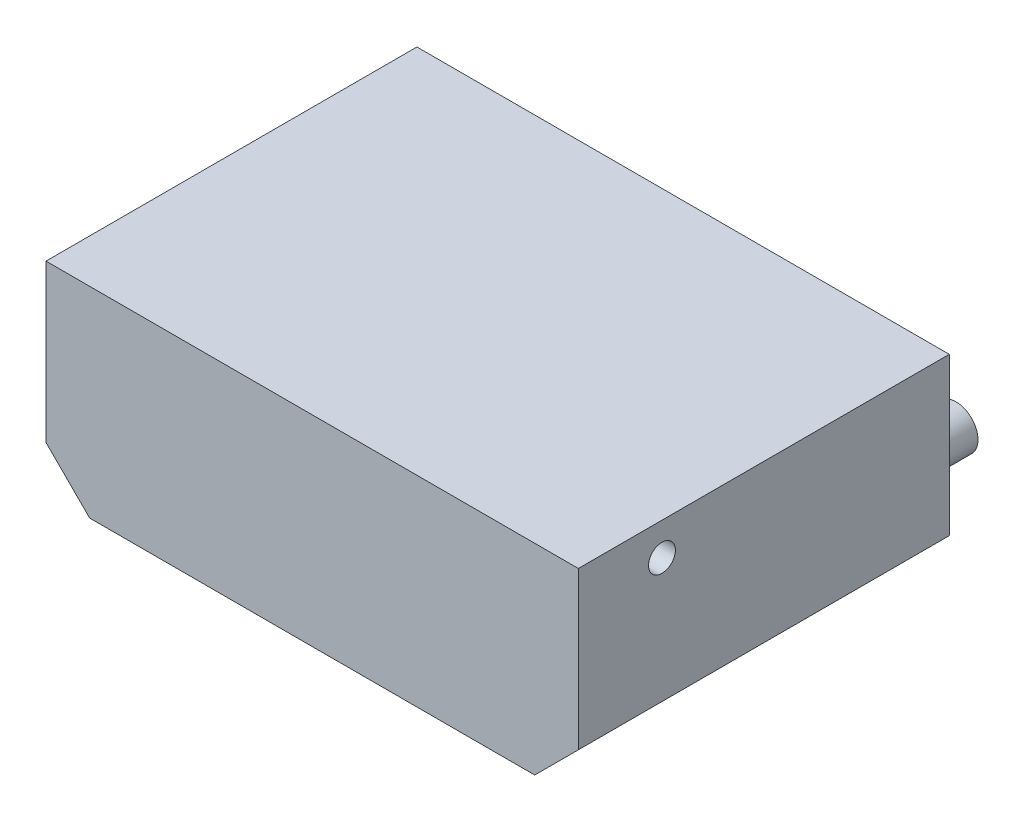
from build123d import *

# Parameters (mm, degrees)
BOSS_EXTRUDE1_DEPTH = 170
SKETCH2_W           = 174
SKETCH2_H           = 140
CUT_EXTRUDE1_DEPTH  = 0.1
SKETCH3_R           = 10
BOSS_EXTRUDE2_DEPTH = 18.7
CUT_EXTRUDE2_DEPTH  = 0.1
CUT_EXTRUDE3_REACH  = 302.919
SKETCH5_R           = 6.160372281


with BuildPart() as part:
    # Sketch1 → Boss-Extrude1 (new body)
    with BuildSketch(Plane.XY):
        Polygon((-102, -46), (-122, -26), (-122, 46), (122, 46), (122, -26), (102, -46), align=None)
    extrude(amount=BOSS_EXTRUDE1_DEPTH)

    # Sketch2 → Cut-Extrude1 (cut)
    with BuildSketch(Plane.XZ.offset(46)):
        with Locations((0, 85)):
            Rectangle(SKETCH2_W, SKETCH2_H)
    extrude(amount=-CUT_EXTRUDE1_DEPTH, mode=Mode.SUBTRACT)

    # Sketch3 → Boss-Extrude2 (add)
    with BuildSketch(Plane(origin=(0, 0, 0), x_dir=(-1, 0, 0), z_dir=(0, 0, -1))):
        with Locations((-76.475491295, 0)):
            Circle(SKETCH3_R)
        with Locations((-106.475491295, 0)):
            Circle(SKETCH3_R)
    extrude(amount=BOSS_EXTRUDE2_DEPTH)

    # Sketch4 → Cut-Extrude2 (cut)
    # profile 1 of 8: a face of its own
    with BuildSketch(Plane.XZ.offset(45.9)):
        with BuildLine():
            Line((-42.268322494, 131.561403862), (-42.268322494, 131.083569118))
            add(Edge.make_bspline(
                [(-42.268322494, 131.083569118), (-42.422310774, 131.050224304), (-42.731367697, 130.983300734), (-43.16425574, 130.761058835), (-43.574269447, 130.460579751), (-43.808169871, 130.202231607), (-43.929544846, 130.068170287)],
                knots=[0, 0, 0, 0, 0.947408205, 1.901463304, 2.911033016, 4, 4, 4, 4], degree=3))
            add(Edge.make_bspline(
                [(-43.929544846, 130.068170287), (-43.977852767, 130.0066807), (-44.085689478, 129.869418846), (-44.238600073, 129.62465817), (-44.411442585, 129.328958663), (-44.596616217, 128.976318721), (-44.800647362, 128.569989633), (-45.025747476, 128.112451902), (-45.259781717, 127.5979898), (-45.420542284, 127.237357907), (-45.504906267, 127.048105382)],
                knots=[0, 0, 0, 0, 0.549484672, 1.226602557, 2.02645952, 2.958032851, 4.026270025, 5.223684279, 6.543044117, 8, 8, 8, 8], degree=3))
            Line((-45.504906267, 127.048105382), (-51.182926935, 114.120435709))
            Line((-51.182926935, 114.120435709), (-51.836216624, 114.120435709))
            Line((-51.836216624, 114.120435709), (-57.738222328, 127.746192078))
            add(Edge.make_bspline(
                [(-57.738222328, 127.746192078), (-57.822436758, 127.935515149), (-57.981782084, 128.29374053), (-58.213763464, 128.798753775), (-58.423274679, 129.242766517), (-58.606248109, 129.627353725), (-58.776129059, 129.945709462), (-58.920816078, 130.204004053), (-59.041781442, 130.402318114), (-59.176862593, 130.590301499), (-59.382327642, 130.761611506), (-59.687730804, 130.916067519), (-60.072261074, 131.022647616), (-60.355754594, 131.06226788), (-60.508170609, 131.083569118)],
                knots=[0, 0, 0, 0, 1.610291577, 3.046893938, 4.318728555, 5.425938633, 6.356009659, 7.122477988, 7.726240531, 8.161409343, 8.91557796, 9.776299492, 10.804460958, 12, 12, 12, 12], degree=3))
            Line((-60.508170609, 131.083569118), (-60.508170609, 131.561403862))
            Line((-60.508170609, 131.561403862), (-52.444709306, 131.561403862))
            Line((-52.444709306, 131.561403862), (-52.444709306, 131.083569118))
            Line((-52.444709306, 131.083569118), (-52.720957517, 131.083569118))
            add(Edge.make_bspline(
                [(-52.720957517, 131.083569118), (-52.891587215, 131.079806061), (-53.203789309, 131.072920774), (-53.628631285, 131.029736009), (-53.969575075, 130.947249337), (-54.152014222, 130.850286848), (-54.232856511, 130.807320907)],
                knots=[0, 0, 0, 0, 1.317031691, 2.409780111, 3.29534303, 4, 4, 4, 4], degree=3))
            add(Edge.make_bspline(
                [(-54.232856511, 130.807320907), (-54.277473498, 130.774801438), (-54.364247837, 130.711555228), (-54.454372234, 130.578245563), (-54.515609876, 130.42667613), (-54.521134191, 130.316468497), (-54.524037058, 130.258557568)],
                knots=[0, 0, 0, 0, 1.014177409, 1.972445466, 2.934578636, 4, 4, 4, 4], degree=3))
            add(Edge.make_bspline(
                [(-54.524037058, 130.258557568), (-54.51759972, 130.177346048), (-54.503328868, 129.997309277), (-54.446781809, 129.789988908), (-54.384882385, 129.622629018), (-54.337993199, 129.492058361), (-54.268189771, 129.329819645), (-54.192197776, 129.129992884), (-54.093307638, 128.898007031), (-53.977200191, 128.631704585), (-53.851295731, 128.326585327), (-53.759084016, 128.113138578), (-53.71022476, 128.000041786)],
                knots=[0, 0, 0, 0, 1.012231494, 2.244002945, 2.655403561, 3.233491586, 3.969557668, 4.852239662, 5.893194298, 7.106928332, 8.467078429, 10, 10, 10, 10], degree=3))
            Line((-53.71022476, 128.000041786), (-50.063001754, 119.589403676))
            Line((-50.063001754, 119.589403676), (-46.796553309, 127.021973795))
            add(Edge.make_bspline(
                [(-46.796553309, 127.021973795), (-46.743992783, 127.141303943), (-46.644010382, 127.368297763), (-46.505697534, 127.694785437), (-46.382886267, 127.988623442), (-46.27524101, 128.250174688), (-46.179403449, 128.477683514), (-46.106823388, 128.675577005), (-46.044908159, 128.838723117), (-45.97140133, 129.078848775), (-45.887522105, 129.382176018), (-45.870792644, 129.649509958), (-45.863282325, 129.769523572)],
                knots=[0, 0, 0, 0, 1.34070385, 2.550331934, 3.645759521, 4.615209621, 5.458693035, 6.183490299, 6.782524973, 7.251937004, 8.766318359, 10, 10, 10, 10], degree=3))
            add(Edge.make_bspline(
                [(-45.863282325, 129.769523572), (-45.865045448, 129.830699261), (-45.868499243, 129.950536727), (-45.907195817, 130.124551074), (-45.971097743, 130.287292593), (-46.061397271, 130.436868186), (-46.174919674, 130.572515024), (-46.31059618, 130.694054574), (-46.472716793, 130.795142895), (-46.592909722, 130.845101569), (-46.654696119, 130.870783334)],
                knots=[0, 0, 0, 0, 1.010725678, 1.979917312, 2.931899074, 3.892303657, 4.857111769, 5.848785412, 6.89414627, 8, 8, 8, 8], degree=3))
            add(Edge.make_bspline(
                [(-46.654696119, 130.870783334), (-46.751106707, 130.904210728), (-46.95670438, 130.975495372), (-47.296999425, 131.038418624), (-47.680496693, 131.074219371), (-47.949983983, 131.08034337), (-48.091933435, 131.083569118)],
                knots=[0, 0, 0, 0, 0.837444138, 1.785867817, 2.833730339, 4, 4, 4, 4], degree=3))
            Line((-48.091933435, 131.083569118), (-48.091933435, 131.561403862))
            Line((-48.091933435, 131.561403862), (-42.268322494, 131.561403862))
        make_face()
    # profile 2 of 8: a face of its own
    with BuildSketch(Plane.XZ.offset(45.9)):
        with BuildLine():
            Line((-32.715360699, 114.837187825), (-32.715360699, 114.359353081))
            Line((-32.715360699, 114.359353081), (-41.555303462, 114.359353081))
            Line((-41.555303462, 114.359353081), (-41.555303462, 114.837187825))
            Line((-41.555303462, 114.837187825), (-40.991607787, 114.837187825))
            add(Edge.make_bspline(
                [(-40.991607787, 114.837187825), (-40.874419273, 114.839376862), (-40.651358234, 114.843543557), (-40.334356413, 114.893064195), (-40.0513912, 114.97148981), (-39.884345139, 115.054896982), (-39.804487095, 115.094770616)],
                knots=[0, 0, 0, 0, 1.144467932, 2.17842344, 3.129177061, 4, 4, 4, 4], degree=3))
            add(Edge.make_bspline(
                [(-39.804487095, 115.094770616), (-39.752023379, 115.126419397), (-39.645901358, 115.190437596), (-39.50960772, 115.326045516), (-39.394109329, 115.491349899), (-39.334814502, 115.616409079), (-39.304253848, 115.680864794)],
                knots=[0, 0, 0, 0, 0.93343552, 1.888125192, 2.911536119, 4, 4, 4, 4], degree=3))
            add(Edge.make_bspline(
                [(-39.304253848, 115.680864794), (-39.292060648, 115.710433858), (-39.26428503, 115.777790994), (-39.243633861, 115.898582112), (-39.21368924, 116.045614439), (-39.198578397, 116.224528994), (-39.183334701, 116.43350563), (-39.171452541, 116.671255716), (-39.17020643, 116.938922919), (-39.167541573, 117.126816344), (-39.166129742, 117.226361544)],
                knots=[0, 0, 0, 0, 0.491154816, 1.118830903, 1.878082211, 2.802823963, 3.878617243, 5.106317376, 6.466938293, 8, 8, 8, 8], degree=3))
            Line((-39.166129742, 117.226361544), (-39.166129742, 128.694395398))
            add(Edge.make_bspline(
                [(-39.166129742, 128.694395398), (-39.167558231, 128.795184295), (-39.170291778, 128.988053327), (-39.171300965, 129.261950421), (-39.183430993, 129.505896596), (-39.198356347, 129.718670999), (-39.21464804, 129.903551704), (-39.242710616, 130.057222647), (-39.26499844, 130.183665593), (-39.311975145, 130.310280089), (-39.386792175, 130.448643644), (-39.513579615, 130.594480937), (-39.672755873, 130.729205177), (-39.864633066, 130.853435273), (-40.093485611, 130.959008057), (-40.36086046, 131.031082097), (-40.664034224, 131.076546195), (-40.878185904, 131.081137441), (-40.991607787, 131.083569118)],
                knots=[0, 0, 0, 0, 1.353963977, 2.590937397, 3.678525439, 4.633585292, 5.456840327, 6.168525469, 6.732370981, 7.176481794, 7.976852204, 8.830756602, 9.755347706, 10.770665926, 11.892520065, 13.125421506, 14.477527201, 16, 16, 16, 16], degree=3))
            Line((-40.991607787, 131.083569118), (-41.555303462, 131.083569118))
            Line((-41.555303462, 131.083569118), (-41.555303462, 131.561403862))
            Line((-41.555303462, 131.561403862), (-32.715360699, 131.561403862))
            Line((-32.715360699, 131.561403862), (-32.715360699, 131.083569118))
            Line((-32.715360699, 131.083569118), (-33.27532329, 131.083569118))
            add(Edge.make_bspline(
                [(-33.27532329, 131.083569118), (-33.392498481, 131.081334313), (-33.615534161, 131.077080502), (-33.931525083, 131.028331721), (-34.212805685, 130.948478265), (-34.378829809, 130.865777225), (-34.458710898, 130.825986326)],
                knots=[0, 0, 0, 0, 1.147815573, 2.184795468, 3.126629849, 4, 4, 4, 4], degree=3))
            add(Edge.make_bspline(
                [(-34.458710898, 130.825986326), (-34.511225686, 130.794376943), (-34.617451015, 130.730438437), (-34.753452299, 130.59368981), (-34.8729542, 130.429823584), (-34.934652862, 130.304433011), (-34.966410313, 130.239892148)],
                knots=[0, 0, 0, 0, 0.928829741, 1.878808762, 2.908183361, 4, 4, 4, 4], degree=3))
            add(Edge.make_bspline(
                [(-34.966410313, 130.239892148), (-34.978547501, 130.210312107), (-35.005733289, 130.144056504), (-35.028045639, 130.023624211), (-35.056402757, 129.876277657), (-35.072253665, 129.696258094), (-35.087141747, 129.488478888), (-35.099390735, 129.250755105), (-35.100386501, 128.983075694), (-35.10310411, 128.793939762), (-35.104534419, 128.694395398)],
                knots=[0, 0, 0, 0, 0.491143652, 1.100100526, 1.878201893, 2.802922625, 3.87869145, 5.087223688, 6.466973141, 8, 8, 8, 8], degree=3))
            Line((-35.104534419, 128.694395398), (-35.104534419, 117.226361544))
            add(Edge.make_bspline(
                [(-35.104534419, 117.226361544), (-35.103152709, 117.12556956), (-35.100508677, 116.932694619), (-35.09889698, 116.658837298), (-35.088670491, 116.414667302), (-35.067759125, 116.200949644), (-35.051125297, 116.016410063), (-35.029613026, 115.860206375), (-35.001284565, 115.735089338), (-34.956396916, 115.606611276), (-34.874104949, 115.472829235), (-34.75021689, 115.325953519), (-34.590258874, 115.191650501), (-34.39862173, 115.067291061), (-34.169694894, 114.961758317), (-33.902342641, 114.889672056), (-33.600395818, 114.844395966), (-33.387496682, 114.839675152), (-33.27532329, 114.837187825)],
                knots=[0, 0, 0, 0, 1.354319329, 2.591617395, 3.679490877, 4.636117144, 5.476222309, 6.168990776, 6.752950479, 7.19717785, 7.991448918, 8.845577426, 9.770411191, 10.785995884, 11.908144457, 13.141369476, 14.493830035, 16, 16, 16, 16], degree=3))
            Line((-33.27532329, 114.837187825), (-32.715360699, 114.837187825))
        make_face()
    # profile 3 of 8: a face of its own
    with BuildSketch(Plane.XZ.offset(45.9)):
        with BuildLine():
            Line((-31.759691211, 114.359353081), (-31.759691211, 114.837187825))
            Line((-31.759691211, 114.837187825), (-31.195995537, 114.837187825))
            add(Edge.make_bspline(
                [(-31.195995537, 114.837187825), (-31.080151575, 114.840045293), (-30.86257918, 114.845412047), (-30.556513148, 114.884747177), (-30.292527296, 114.954746527), (-30.066789049, 115.052566443), (-29.87652939, 115.177283927), (-29.719286986, 115.326905307), (-29.579649252, 115.490085591), (-29.514975778, 115.617102783), (-29.48251001, 115.680864794)],
                knots=[0, 0, 0, 0, 1.370884423, 2.574727263, 3.642922677, 4.592448042, 5.474721649, 6.318802883, 7.15604725, 8, 8, 8, 8], degree=3))
            add(Edge.make_bspline(
                [(-29.48251001, 115.680864794), (-29.47319392, 115.708074637), (-29.451532351, 115.771342371), (-29.431020412, 115.885618797), (-29.414235585, 116.030371421), (-29.393326406, 116.206766102), (-29.384466444, 116.416224816), (-29.378081699, 116.657675891), (-29.36825091, 116.931385686), (-29.369733364, 117.124314181), (-29.370517492, 117.226361544)],
                knots=[0, 0, 0, 0, 0.443546268, 1.031324162, 1.786729535, 2.694794477, 3.772216006, 5.021594906, 6.424606037, 8, 8, 8, 8], degree=3))
            Line((-29.370517492, 117.226361544), (-29.370517492, 128.694395398))
            add(Edge.make_bspline(
                [(-29.370517492, 128.694395398), (-29.37194598, 128.795184295), (-29.374679527, 128.988053327), (-29.375688715, 129.261950421), (-29.387818743, 129.505896596), (-29.402744097, 129.718670999), (-29.41903579, 129.903551704), (-29.447098366, 130.057222647), (-29.469386189, 130.183665593), (-29.516362895, 130.310280089), (-29.591179925, 130.448643644), (-29.717967364, 130.594480937), (-29.877143623, 130.729205177), (-30.069020815, 130.853435273), (-30.29787336, 130.959008057), (-30.565248209, 131.031082097), (-30.868421974, 131.076546195), (-31.082573653, 131.081137441), (-31.195995537, 131.083569118)],
                knots=[0, 0, 0, 0, 1.353963977, 2.590937397, 3.678525439, 4.633585292, 5.456840327, 6.168525469, 6.732370981, 7.176481794, 7.976852204, 8.830756602, 9.755347706, 10.770665926, 11.892520065, 13.125421506, 14.477527201, 16, 16, 16, 16], degree=3))
            Line((-31.195995537, 131.083569118), (-31.759691211, 131.083569118))
            Line((-31.759691211, 131.083569118), (-31.759691211, 131.561403862))
            Line((-31.759691211, 131.561403862), (-24.114335308, 131.561403862))
            add(Edge.make_bspline(
                [(-24.114335308, 131.561403862), (-23.865383885, 131.560124262), (-23.379559232, 131.557627144), (-22.67126664, 131.513037034), (-21.999250415, 131.453627421), (-21.365905459, 131.357617368), (-20.766306562, 131.246162335), (-20.206864378, 131.097375322), (-19.680210508, 130.934664691), (-19.351124788, 130.793929074), (-19.190397596, 130.72519306)],
                knots=[0, 0, 0, 0, 1.187623187, 2.317627336, 3.38521285, 4.405435058, 5.373093369, 6.293321195, 7.166449119, 8, 8, 8, 8], degree=3))
            add(Edge.make_bspline(
                [(-19.190397596, 130.72519306), (-19.004595225, 130.637486942), (-18.636513693, 130.463737802), (-18.119266561, 130.151400669), (-17.635501419, 129.810516103), (-17.183386127, 129.44028044), (-16.77024909, 129.031742645), (-16.387126388, 128.593512721), (-16.038483432, 128.122475013), (-15.730597701, 127.616933513), (-15.455019575, 127.089269228), (-15.217155889, 126.541988624), (-15.007319995, 125.980458122), (-14.847491788, 125.397153452), (-14.713158424, 124.799899151), (-14.627046854, 124.184267066), (-14.567646553, 123.55261676), (-14.561004194, 123.124777728), (-14.55764043, 122.908115296)],
                knots=[0, 0, 0, 0, 1.023059056, 2.026718722, 3.005407045, 3.969834614, 4.934282109, 5.896555333, 6.867417257, 7.849868272, 8.842554442, 9.830817097, 10.821274577, 11.826120625, 12.841487115, 13.869025607, 14.920850928, 16, 16, 16, 16], degree=3))
            add(Edge.make_bspline(
                [(-14.55764043, 122.908115296), (-14.564820927, 122.611608679), (-14.578959429, 122.027782845), (-14.690332455, 121.170883879), (-14.867186533, 120.347571096), (-15.122747714, 119.568686484), (-15.42829111, 118.839557875), (-15.787161272, 118.174599664), (-16.178919724, 117.569557077), (-16.624354129, 117.036311082), (-17.108018404, 116.564515165), (-17.618565384, 116.134474991), (-18.172130885, 115.762678566), (-18.759917593, 115.427420576), (-19.404309473, 115.143944025), (-20.10770071, 114.893658104), (-20.879734997, 114.682383422), (-21.419612803, 114.570378423), (-21.699030001, 114.512409522)],
                knots=[0, 0, 0, 0, 1.173207418, 2.310062444, 3.414262259, 4.501404309, 5.549709881, 6.539078478, 7.4884477, 8.39776528, 9.28236543, 10.160152656, 11.035781795, 11.917910606, 12.835037278, 13.817998386, 14.87069116, 16, 16, 16, 16], degree=3))
            add(Edge.make_bspline(
                [(-21.699030001, 114.512409522), (-21.844373357, 114.488127653), (-22.170908545, 114.433574867), (-22.721164441, 114.39020011), (-23.38117402, 114.366651718), (-23.85796762, 114.361905227), (-24.114335308, 114.359353081)],
                knots=[0, 0, 0, 0, 0.729469202, 1.638859668, 2.730435796, 4, 4, 4, 4], degree=3))
            Line((-24.114335308, 114.359353081), (-31.759691211, 114.359353081))
        make_face()
        with BuildLine():
            Line((-25.308922168, 130.605734374), (-25.308922168, 117.181564537))
            add(Edge.make_bspline(
                [(-25.308922168, 117.181564537), (-25.307605699, 117.021014182), (-25.305247175, 116.733379877), (-25.287206724, 116.353474614), (-25.26342519, 116.075531274), (-25.211529802, 115.844318532), (-25.079220237, 115.647408355), (-24.936921745, 115.553222475), (-24.86468518, 115.505409849)],
                knots=[0, 0, 0, 0, 1.581619866, 2.833554187, 3.746016832, 4.328809972, 5.15163522, 6, 6, 6, 6], degree=3))
            add(Edge.make_bspline(
                [(-24.86468518, 115.505409849), (-24.801998647, 115.475891329), (-24.667045353, 115.412343047), (-24.433912422, 115.358342607), (-24.165483299, 115.318810082), (-23.973917754, 115.316340508), (-23.871684853, 115.315022569)],
                knots=[0, 0, 0, 0, 0.812832084, 1.749887298, 2.799180973, 4, 4, 4, 4], degree=3))
            add(Edge.make_bspline(
                [(-23.871684853, 115.315022569), (-23.699764155, 115.319206319), (-23.364498403, 115.32736513), (-22.875891499, 115.394285076), (-22.420047206, 115.511356394), (-21.992844994, 115.665749894), (-21.60285145, 115.875174113), (-21.23991064, 116.122583457), (-20.908463916, 116.418005486), (-20.719349649, 116.647587066), (-20.623901827, 116.763459136)],
                knots=[0, 0, 0, 0, 1.117658457, 2.179566554, 3.198078308, 4.173511569, 5.125438597, 6.068069882, 7.024935961, 8, 8, 8, 8], degree=3))
            add(Edge.make_bspline(
                [(-20.623901827, 116.763459136), (-20.500027729, 116.934869725), (-20.245915298, 117.286497403), (-19.9396462, 117.88395974), (-19.679314856, 118.544875642), (-19.461974004, 119.271248082), (-19.301603461, 120.066463439), (-19.184042871, 120.926775562), (-19.106726207, 121.853983084), (-19.100360213, 122.494824014), (-19.097070497, 122.82598745)],
                knots=[0, 0, 0, 0, 0.797088956, 1.635129663, 2.524519068, 3.475303084, 4.491981832, 5.582369658, 6.750656001, 8, 8, 8, 8], degree=3))
            add(Edge.make_bspline(
                [(-19.097070497, 122.82598745), (-19.099501453, 123.094848376), (-19.104243803, 123.619346963), (-19.153725347, 124.385510737), (-19.234120376, 125.110930577), (-19.350720649, 125.794731112), (-19.493281556, 126.43790738), (-19.674590069, 127.038493572), (-19.882483799, 127.600117323), (-20.057109052, 127.949154628), (-20.142334, 128.119500472)],
                knots=[0, 0, 0, 0, 1.184457476, 2.310660313, 3.381113584, 4.398734162, 5.365689401, 6.281539716, 7.161314381, 8, 8, 8, 8], degree=3))
            add(Edge.make_bspline(
                [(-20.142334, 128.119500472), (-20.211872174, 128.243482252), (-20.348604395, 128.487266392), (-20.573096368, 128.831834391), (-20.824351786, 129.137299489), (-21.078814106, 129.420451703), (-21.355512701, 129.666817902), (-21.640085726, 129.889700125), (-21.946732047, 130.073362265), (-22.159829769, 130.174401968), (-22.26645876, 130.224959813)],
                knots=[0, 0, 0, 0, 1.119018596, 2.200315138, 3.231417848, 4.229706666, 5.193717379, 6.14394327, 7.071273713, 8, 8, 8, 8], degree=3))
            add(Edge.make_bspline(
                [(-22.26645876, 130.224959813), (-22.3492939, 130.257665654), (-22.5234614, 130.3264323), (-22.811869899, 130.402139849), (-23.135592406, 130.469785869), (-23.498757719, 130.519820775), (-23.898448113, 130.560482041), (-24.335408952, 130.590750873), (-24.809841736, 130.604312321), (-25.138438727, 130.605248608), (-25.308922168, 130.605734374)],
                knots=[0, 0, 0, 0, 0.692518899, 1.456076319, 2.316420686, 3.265494417, 4.307135134, 5.442799475, 6.673267388, 8, 8, 8, 8], degree=3))
        make_face(mode=Mode.SUBTRACT)
    # profile 4 of 8: a face of its own
    with BuildSketch(Plane.XZ.offset(45.9)):
        with BuildLine():
            Line((-6.434449783, 130.366817002), (-6.434449783, 123.677130587))
            Line((-6.434449783, 123.677130587), (-6.098472229, 123.677130587))
            add(Edge.make_bspline(
                [(-6.098472229, 123.677130587), (-5.968899056, 123.679496754), (-5.718717385, 123.684065381), (-5.35699716, 123.733247016), (-5.023105412, 123.81548565), (-4.715757446, 123.926778253), (-4.433862328, 124.069110137), (-4.183693263, 124.249622122), (-3.961140454, 124.461367503), (-3.764385303, 124.703705381), (-3.594480631, 124.979679253), (-3.436403292, 125.283806612), (-3.296416844, 125.618681733), (-3.171539245, 125.983771759), (-3.070674404, 126.380542573), (-2.975376063, 126.805559799), (-2.901065582, 127.261805475), (-2.86779656, 127.576768103), (-2.850689204, 127.738725911)],
                knots=[0, 0, 0, 0, 1.062093487, 2.05070476, 2.986276895, 3.877322359, 4.726232003, 5.567315723, 6.39743211, 7.238949076, 8.11947221, 9.050581245, 10.047531836, 11.093122518, 12.211943632, 13.402946799, 14.664562062, 16, 16, 16, 16], degree=3))
            Line((-2.850689204, 127.738725911), (-2.37285446, 127.738725911))
            Line((-2.37285446, 127.738725911), (-2.37285446, 118.659865776))
            Line((-2.37285446, 118.659865776), (-2.850689204, 118.659865776))
            add(Edge.make_bspline(
                [(-2.850689204, 118.659865776), (-2.87989522, 118.897990324), (-2.936022973, 119.35561506), (-3.066648075, 120.005326337), (-3.246677607, 120.586590556), (-3.465376893, 121.098087993), (-3.713226383, 121.536902013), (-3.979167752, 121.905218204), (-4.269502815, 122.192743713), (-4.593069699, 122.407021219), (-4.961768657, 122.553976158), (-5.39124164, 122.650286985), (-5.888725663, 122.71480052), (-6.245070213, 122.719149716), (-6.434449783, 122.721461099)],
                knots=[0, 0, 0, 0, 1.403482868, 2.697195568, 3.871661546, 4.957716503, 5.945698591, 6.815061024, 7.607980598, 8.3228477, 9.070553376, 9.91645821, 10.892700197, 12, 12, 12, 12], degree=3))
            Line((-6.434449783, 122.721461099), (-6.434449783, 117.808722638))
            add(Edge.make_bspline(
                [(-6.434449783, 117.808722638), (-6.435299715, 117.694228822), (-6.436907421, 117.477655819), (-6.426238047, 117.170392013), (-6.422501051, 116.897614183), (-6.405307411, 116.660102878), (-6.391428352, 116.457128551), (-6.375158554, 116.288350656), (-6.348463993, 116.155402298), (-6.315524962, 116.023943542), (-6.252488656, 115.889605388), (-6.148075197, 115.753266889), (-6.029545081, 115.621395477), (-5.874419551, 115.511829463), (-5.68277549, 115.419066647), (-5.442920437, 115.360531114), (-5.158024987, 115.317750583), (-4.95138179, 115.31597564), (-4.840422942, 115.315022569)],
                knots=[0, 0, 0, 0, 1.552990816, 2.937589936, 4.170316776, 5.252766198, 6.166801655, 6.931091326, 7.550164809, 8.004681738, 8.767478654, 9.540664334, 10.328815109, 11.162812995, 12.099025042, 13.200523488, 14.496796931, 16, 16, 16, 16], degree=3))
            Line((-4.840422942, 115.315022569), (-3.839956447, 115.315022569))
            add(Edge.make_bspline(
                [(-3.839956447, 115.315022569), (-3.649477863, 115.319142224), (-3.276613649, 115.327206502), (-2.731207931, 115.374483441), (-2.214023238, 115.45907396), (-1.728306135, 115.584288703), (-1.269343718, 115.734844059), (-0.842415531, 115.926596095), (-0.444277528, 116.15226126), (-0.071830687, 116.409312646), (0.269655703, 116.708598792), (0.58727955, 117.040735676), (0.879522601, 117.410193399), (1.149943494, 117.812926025), (1.387338251, 118.257594797), (1.603839619, 118.734889204), (1.795093089, 119.249121), (1.900010679, 119.60736159), (1.953789823, 119.790990209)],
                knots=[0, 0, 0, 0, 1.142897584, 2.237236343, 3.281746819, 4.283100764, 5.244004367, 6.176409463, 7.085783423, 7.986720822, 8.886419989, 9.805245571, 10.740366748, 11.709443732, 12.71166011, 13.76082962, 14.852235686, 16, 16, 16, 16], degree=3))
            Line((1.953789823, 119.790990209), (2.405492979, 119.790990209))
            Line((2.405492979, 119.790990209), (1.64767694, 114.359353081))
            Line((1.64767694, 114.359353081), (-12.885218826, 114.359353081))
            Line((-12.885218826, 114.359353081), (-12.885218826, 114.837187825))
            Line((-12.885218826, 114.837187825), (-12.321523152, 114.837187825))
            add(Edge.make_bspline(
                [(-12.321523152, 114.837187825), (-12.204334638, 114.839376862), (-11.981273598, 114.843543557), (-11.664271778, 114.893064195), (-11.381306564, 114.97148981), (-11.214260504, 115.054896982), (-11.13440246, 115.094770616)],
                knots=[0, 0, 0, 0, 1.144467932, 2.17842344, 3.129177061, 4, 4, 4, 4], degree=3))
            add(Edge.make_bspline(
                [(-11.13440246, 115.094770616), (-11.081938744, 115.126419397), (-10.975816722, 115.190437596), (-10.839523085, 115.326045516), (-10.724024693, 115.491349899), (-10.664729867, 115.616409079), (-10.634169212, 115.680864794)],
                knots=[0, 0, 0, 0, 0.93343552, 1.888125192, 2.911536119, 4, 4, 4, 4], degree=3))
            add(Edge.make_bspline(
                [(-10.634169212, 115.680864794), (-10.621976013, 115.710433858), (-10.594200395, 115.777790994), (-10.573549225, 115.898582112), (-10.543604604, 116.045614439), (-10.528493762, 116.224528994), (-10.513250065, 116.43350563), (-10.501367906, 116.671255716), (-10.500121794, 116.938922919), (-10.497456937, 117.126816344), (-10.496045107, 117.226361544)],
                knots=[0, 0, 0, 0, 0.491154816, 1.118830903, 1.878082211, 2.802823963, 3.878617243, 5.106317376, 6.466938293, 8, 8, 8, 8], degree=3))
            Line((-10.496045107, 117.226361544), (-10.496045107, 128.694395398))
            add(Edge.make_bspline(
                [(-10.496045107, 128.694395398), (-10.496712658, 128.863640663), (-10.497910513, 129.167334786), (-10.506850201, 129.568225493), (-10.525806979, 129.86135406), (-10.550095268, 130.018479751), (-10.559507534, 130.079369539)],
                knots=[0, 0, 0, 0, 1.46329711, 2.625743972, 3.467444458, 4, 4, 4, 4], degree=3))
            add(Edge.make_bspline(
                [(-10.559507534, 130.079369539), (-10.58226316, 130.147449406), (-10.626781734, 130.280639265), (-10.728789968, 130.462548054), (-10.860600194, 130.619046549), (-10.968430173, 130.699733465), (-11.022409942, 130.740125396)],
                knots=[0, 0, 0, 0, 1.044138947, 2.04272901, 3.020188662, 4, 4, 4, 4], degree=3))
            add(Edge.make_bspline(
                [(-11.022409942, 130.740125396), (-11.106571478, 130.793270645), (-11.281520398, 130.903745148), (-11.590824829, 131.008602457), (-11.941855443, 131.071636529), (-12.190554659, 131.079452905), (-12.321523152, 131.083569118)],
                knots=[0, 0, 0, 0, 0.872834083, 1.81438441, 2.849024194, 4, 4, 4, 4], degree=3))
            Line((-12.321523152, 131.083569118), (-12.885218826, 131.083569118))
            Line((-12.885218826, 131.083569118), (-12.885218826, 131.561403862))
            Line((-12.885218826, 131.561403862), (1.21090612, 131.561403862))
            Line((1.21090612, 131.561403862), (1.21090612, 126.305221679))
            Line((1.21090612, 126.305221679), (0.733071376, 126.305221679))
            add(Edge.make_bspline(
                [(0.733071376, 126.305221679), (0.703163859, 126.453562698), (0.645100176, 126.741558053), (0.541094548, 127.155305667), (0.425228486, 127.536113116), (0.302539307, 127.88389906), (0.172449608, 128.200226377), (0.030814078, 128.483005431), (-0.117116784, 128.73607153), (-0.333726288, 129.025804387), (-0.641381544, 129.345729583), (-1.075903275, 129.671889471), (-1.57932392, 129.940996445), (-1.947783531, 130.071726698), (-2.137670172, 130.139098882)],
                knots=[0, 0, 0, 0, 1.069557103, 2.076482136, 3.014180904, 3.882168483, 4.682592328, 5.429982227, 6.116341669, 6.751412971, 7.983148368, 9.239203021, 10.577215927, 12, 12, 12, 12], degree=3))
            add(Edge.make_bspline(
                [(-2.137670172, 130.139098882), (-2.2022074, 130.157157378), (-2.342662827, 130.196458938), (-2.575344473, 130.245716727), (-2.847867628, 130.278842764), (-3.157320785, 130.315387416), (-3.505147305, 130.333889149), (-3.88953004, 130.354251228), (-4.312758419, 130.364791568), (-4.60772382, 130.366121355), (-4.76202818, 130.366817002)],
                knots=[0, 0, 0, 0, 0.608728222, 1.324804056, 2.157687748, 3.10140268, 4.154841575, 5.320503916, 6.598283308, 8, 8, 8, 8], degree=3))
            Line((-4.76202818, 130.366817002), (-6.434449783, 130.366817002))
        make_face()
    # profile 5 of 8: a face of its own
    with BuildSketch(Plane.XZ.offset(45.9)):
        with BuildLine():
            add(Edge.make_bspline(
                [(13.522616943, 131.800321234), (13.855046745, 131.805504483), (14.50512698, 131.815640542), (15.458774133, 131.722028973), (16.365327198, 131.552203177), (17.225293419, 131.299870136), (18.033859019, 130.955945454), (18.797205793, 130.532305993), (19.51228081, 130.022787899), (20.170401443, 129.432969396), (20.763254221, 128.783237139), (21.286671577, 128.089506112), (21.729399361, 127.355576978), (22.089508415, 126.580475254), (22.371880541, 125.76658668), (22.566931818, 124.911469773), (22.69038344, 124.017947748), (22.705679389, 123.408760711), (22.713469596, 123.098502577)],
                knots=[0, 0, 0, 0, 1.117599178, 2.185511443, 3.216596641, 4.216496892, 5.193720437, 6.166199278, 7.147635958, 8.140749636, 9.133263309, 10.101842832, 11.059452728, 12.010747998, 12.971773146, 13.951566087, 14.956735376, 16, 16, 16, 16], degree=3))
            add(Edge.make_bspline(
                [(22.713469596, 123.098502577), (22.707885412, 122.831957648), (22.696867316, 122.306040585), (22.604699609, 121.529403425), (22.454530333, 120.777222872), (22.251294839, 120.046386223), (21.980834273, 119.342229499), (21.648671135, 118.665159301), (21.267441918, 118.006059271), (20.963052797, 117.596895019), (20.809596788, 117.390617237)],
                knots=[0, 0, 0, 0, 1.043246653, 2.058419255, 3.056808262, 4.043829632, 5.024555343, 6.005002729, 6.994233708, 8, 8, 8, 8], degree=3))
            add(Edge.make_bspline(
                [(20.809596788, 117.390617237), (20.70295386, 117.257329972), (20.491738158, 116.993342817), (20.148801277, 116.624415114), (19.796705136, 116.274483209), (19.420056985, 115.958436371), (19.032783891, 115.662310753), (18.628042642, 115.392078777), (18.205932554, 115.150116944), (17.768504019, 114.932777337), (17.314026732, 114.742728196), (16.845360103, 114.573077864), (16.356622307, 114.436783709), (15.853703563, 114.32028049), (15.333930529, 114.230675105), (14.799180893, 114.169313353), (14.248836824, 114.124481896), (13.87611036, 114.121798235), (13.686872637, 114.120435709)],
                knots=[0, 0, 0, 0, 1.00627325, 1.9930127, 2.968556301, 3.931628562, 4.889992766, 5.842467438, 6.799060146, 7.757311971, 8.720859362, 9.702647782, 10.694476427, 11.710892394, 12.745970349, 13.802697082, 14.884402792, 16, 16, 16, 16], degree=3))
            add(Edge.make_bspline(
                [(13.686872637, 114.120435709), (13.497657841, 114.122168565), (13.123823467, 114.125592192), (12.570912668, 114.165389182), (12.033689331, 114.223096582), (11.51258686, 114.30872309), (11.009253851, 114.42344258), (10.51847165, 114.549772133), (10.048578852, 114.712627391), (9.594337812, 114.896979513), (9.153850358, 115.100231541), (8.731002899, 115.332201597), (8.327387037, 115.591497195), (7.938677457, 115.871986915), (7.563760735, 116.17360723), (7.208736305, 116.504479438), (6.868507823, 116.858565957), (6.656114998, 117.110673328), (6.549216149, 117.237560796)],
                knots=[0, 0, 0, 0, 1.12499151, 2.222661784, 3.294793131, 4.33735381, 5.360698186, 6.364076506, 7.349253377, 8.315262806, 9.278632822, 10.232406028, 11.180767221, 12.129590213, 13.081869556, 14.040110377, 15.013573345, 16, 16, 16, 16], degree=3))
            add(Edge.make_bspline(
                [(6.549216149, 117.237560796), (6.389937944, 117.445214182), (6.07315046, 117.858214779), (5.666873313, 118.520773598), (5.325387769, 119.21259416), (5.044700257, 119.932117925), (4.823615408, 120.679957228), (4.667438287, 121.45689035), (4.571423653, 122.262349985), (4.561026882, 122.809541031), (4.555749327, 123.087303325)],
                knots=[0, 0, 0, 0, 0.995754374, 1.980450006, 2.952842694, 3.929288476, 4.917067138, 5.917621276, 6.942953664, 8, 8, 8, 8], degree=3))
            add(Edge.make_bspline(
                [(4.555749327, 123.087303325), (4.563745848, 123.397515454), (4.579446894, 124.006612158), (4.700046614, 124.901356942), (4.906119389, 125.755026725), (5.19145688, 126.570363686), (5.554004981, 127.347415496), (6.001324899, 128.083073552), (6.532293107, 128.777151838), (7.137162871, 129.424946233), (7.798474156, 130.013817181), (8.504242968, 130.527928708), (9.251081391, 130.949741869), (10.033415098, 131.293256111), (10.853263624, 131.551483967), (11.711832873, 131.721692691), (12.605928882, 131.815380483), (13.213816855, 131.805394167), (13.522616943, 131.800321234)],
                knots=[0, 0, 0, 0, 1.060255294, 2.081794832, 3.079505486, 4.0575798, 5.030022739, 6.005429218, 6.99491703, 8.012249652, 9.030720031, 10.017772549, 10.991257006, 11.957043232, 12.933793802, 13.923226749, 14.945023109, 16, 16, 16, 16], degree=3))
        make_face()
        with BuildLine():
            add(Edge.make_bspline(
                [(13.671940301, 130.844651746), (13.480921039, 130.838023845), (13.107869311, 130.825079862), (12.567741284, 130.707717385), (12.06139104, 130.526519967), (11.592459278, 130.262250079), (11.156014426, 129.929371585), (10.762411476, 129.514015953), (10.401468035, 129.030028544), (10.199785724, 128.668359519), (10.095645889, 128.481609614)],
                knots=[0, 0, 0, 0, 1.010341478, 1.973149883, 2.913323355, 3.848402755, 4.811842333, 5.809142135, 6.868737798, 8, 8, 8, 8], degree=3))
            add(Edge.make_bspline(
                [(10.095645889, 128.481609614), (10.01389129, 128.312549616), (9.844680671, 127.962639677), (9.649477476, 127.392469947), (9.476305037, 126.773269679), (9.335508116, 126.101122186), (9.229245133, 125.375366722), (9.152171071, 124.598042978), (9.102054656, 123.768626715), (9.097516207, 123.198127703), (9.095179394, 122.904382212)],
                knots=[0, 0, 0, 0, 0.787943638, 1.630837067, 2.525905988, 3.487208031, 4.51219802, 5.604605297, 6.766629954, 8, 8, 8, 8], degree=3))
            add(Edge.make_bspline(
                [(9.095179394, 122.904382212), (9.098426009, 122.55579756), (9.104707107, 121.881404424), (9.182544143, 120.905844547), (9.298199534, 120.000184966), (9.464885934, 119.165111602), (9.680507003, 118.399183525), (9.943888821, 117.703443798), (10.255196844, 117.074588496), (10.511836108, 116.702294972), (10.63694306, 116.52080868)],
                knots=[0, 0, 0, 0, 1.253361503, 2.424829634, 3.517270749, 4.535371114, 5.484506921, 6.375489106, 7.20808062, 8, 8, 8, 8], degree=3))
            add(Edge.make_bspline(
                [(10.63694306, 116.52080868), (10.728798175, 116.405132847), (10.908332711, 116.179039752), (11.220998032, 115.884963309), (11.556614199, 115.630921496), (11.926518735, 115.431954613), (12.316402363, 115.26710611), (12.73622536, 115.156885085), (13.181857912, 115.088117532), (13.488755879, 115.080171514), (13.645808713, 115.076105197)],
                knots=[0, 0, 0, 0, 1.020058884, 1.99374635, 2.959073536, 3.921751619, 4.889988268, 5.879249688, 6.914721236, 8, 8, 8, 8], degree=3))
            add(Edge.make_bspline(
                [(13.645808713, 115.076105197), (13.854368688, 115.08186431), (14.257789997, 115.093004266), (14.833915194, 115.218694743), (15.363763617, 115.405826699), (15.670967689, 115.602642612), (15.822196649, 115.699530214)],
                knots=[0, 0, 0, 0, 1.086516288, 2.101667992, 3.065498145, 4, 4, 4, 4], degree=3))
            add(Edge.make_bspline(
                [(15.822196649, 115.699530214), (15.91299245, 115.768982675), (16.097513785, 115.910128638), (16.356071695, 116.153146856), (16.59293486, 116.431621911), (16.818852351, 116.735099793), (17.027256958, 117.068982938), (17.222524627, 117.431023254), (17.395502391, 117.826072672), (17.562505822, 118.24785498), (17.705619313, 118.703709402), (17.835132086, 119.191341866), (17.935019195, 119.713553617), (18.027783466, 120.266836385), (18.092059823, 120.853975585), (18.14200748, 121.473850629), (18.165818683, 122.127719115), (18.171254426, 122.574614113), (18.174039529, 122.803588946)],
                knots=[0, 0, 0, 0, 0.707878774, 1.438598863, 2.192768746, 2.969795667, 3.780358143, 4.628744544, 5.515519471, 6.450279976, 7.437595481, 8.473401936, 9.573958948, 10.729714514, 11.947871327, 13.231394215, 14.581454142, 16, 16, 16, 16], degree=3))
            add(Edge.make_bspline(
                [(18.174039529, 122.803588946), (18.171752655, 123.073644461), (18.167324992, 123.596504497), (18.137304576, 124.35463243), (18.089548139, 125.060574335), (18.023855954, 125.714608224), (17.936653387, 126.315634981), (17.821778837, 126.862705091), (17.700232195, 127.359751734), (17.547929793, 127.804867231), (17.380334558, 128.206163607), (17.21141122, 128.579015622), (17.022530011, 128.916934828), (16.831625538, 129.230344492), (16.619883802, 129.5053993), (16.404010785, 129.756066937), (16.171920642, 129.971512511), (15.853686833, 130.220329135), (15.427942743, 130.474642096), (14.874445244, 130.686893772), (14.28590588, 130.82458051), (13.87929012, 130.837873244), (13.671940301, 130.844651746)],
                knots=[0, 0, 0, 0, 1.564715362, 3.029477591, 4.395383686, 5.663787164, 6.837420581, 7.912070591, 8.901835802, 9.800165859, 10.634314221, 11.421391877, 12.170015688, 12.876189058, 13.5452815, 14.178775877, 14.79090283, 15.376466922, 16.517763855, 17.647800425, 18.800518316, 20, 20, 20, 20], degree=3))
        make_face(mode=Mode.SUBTRACT)
    # profile 6 of 8: a face of its own
    with BuildSketch(Plane.XZ.offset(45.9)):
        with BuildLine():
            Line((27.491817035, 131.083569118), (27.491817035, 131.561403862))
            Line((27.491817035, 131.561403862), (36.57067717, 131.561403862))
            Line((36.57067717, 131.561403862), (36.57067717, 131.083569118))
            Line((36.57067717, 131.083569118), (36.021913831, 131.083569118))
            add(Edge.make_bspline(
                [(36.021913831, 131.083569118), (35.903509535, 131.081240643), (35.676796453, 131.076782227), (35.355740346, 131.028766776), (35.069622942, 130.948435011), (34.901002571, 130.865766986), (34.819860803, 130.825986326)],
                knots=[0, 0, 0, 0, 1.143114955, 2.188764464, 3.128415797, 4, 4, 4, 4], degree=3))
            add(Edge.make_bspline(
                [(34.819860803, 130.825986326), (34.768519229, 130.794391416), (34.664519276, 130.730391253), (34.532666127, 130.5923966), (34.412915437, 130.429983345), (34.351327839, 130.3044873), (34.319627556, 130.239892148)],
                knots=[0, 0, 0, 0, 0.919805455, 1.863201995, 2.900150267, 4, 4, 4, 4], degree=3))
            add(Edge.make_bspline(
                [(34.319627556, 130.239892148), (34.307490368, 130.210312107), (34.28030458, 130.144056504), (34.25799223, 130.023624211), (34.229635112, 129.876277657), (34.213784204, 129.696258094), (34.198896122, 129.488478888), (34.186647134, 129.250755105), (34.185651368, 128.983075694), (34.182933759, 128.793939762), (34.18150345, 128.694395398)],
                knots=[0, 0, 0, 0, 0.491143652, 1.100100526, 1.878201893, 2.802922625, 3.87869145, 5.087223688, 6.466973141, 8, 8, 8, 8], degree=3))
            Line((34.18150345, 128.694395398), (34.18150345, 120.317355044))
            add(Edge.make_bspline(
                [(34.18150345, 120.317355044), (34.180073274, 120.119485569), (34.177310877, 119.737298992), (34.156163217, 119.18434559), (34.115081539, 118.67385066), (34.059388067, 118.204304334), (33.990057119, 117.776678626), (33.905073719, 117.391219292), (33.805017507, 117.047314127), (33.684969933, 116.741111988), (33.542525357, 116.462639494), (33.38212486, 116.199121112), (33.193951422, 115.949655009), (32.984324883, 115.708852028), (32.747882174, 115.48083001), (32.486076586, 115.265053309), (32.201454469, 115.059902978), (31.896521093, 114.864775111), (31.569037786, 114.691233123), (31.22569361, 114.536476461), (30.863625435, 114.411089087), (30.488127792, 114.301461895), (30.093751746, 114.218863698), (29.682910567, 114.166337767), (29.25713557, 114.125234447), (28.967735787, 114.122051718), (28.820794917, 114.120435709)],
                knots=[0, 0, 0, 0, 1.505497279, 2.907880824, 4.209142007, 5.40110598, 6.504661788, 7.503861046, 8.402553078, 9.227120721, 10.00197684, 10.779777326, 11.571286615, 12.376438297, 13.206693614, 14.067377457, 14.955585101, 15.874887265, 16.819438452, 17.773056631, 18.737284655, 19.732168474, 20.747872773, 21.798967748, 22.882440089, 24, 24, 24, 24], degree=3))
            add(Edge.make_bspline(
                [(28.820794917, 114.120435709), (28.64147226, 114.124076806), (28.291996876, 114.131172809), (27.780472984, 114.184834722), (27.295022353, 114.26997064), (26.834172563, 114.387175719), (26.401843768, 114.546931295), (25.994490049, 114.735442016), (25.613165835, 114.962073762), (25.263602694, 115.220609688), (24.948450774, 115.499928702), (24.668329228, 115.786259054), (24.437604055, 116.086554602), (24.244266013, 116.390418922), (24.092301759, 116.701480297), (23.98810381, 117.0220645), (23.921549132, 117.349307636), (23.91256339, 117.570736713), (23.908056456, 117.681797785)],
                knots=[0, 0, 0, 0, 1.284531702, 2.50337698, 3.680324039, 4.81336938, 5.904827366, 6.977667383, 8.024979121, 9.07698531, 10.087568935, 11.039637744, 11.941947136, 12.795274823, 13.616663969, 14.414493008, 15.204765209, 16, 16, 16, 16], degree=3))
            add(Edge.make_bspline(
                [(23.908056456, 117.681797785), (23.914273215, 117.81929016), (23.926255528, 118.084295873), (24.024991633, 118.461883399), (24.1916179, 118.798581767), (24.425653852, 119.085043618), (24.703728421, 119.320996935), (25.019029948, 119.49152366), (25.363458363, 119.597791941), (25.603348787, 119.60953032), (25.726068333, 119.615535264)],
                knots=[0, 0, 0, 0, 1.111024597, 2.141412317, 3.13183341, 4.127000835, 5.113012515, 6.063438972, 7.009323149, 8, 8, 8, 8], degree=3))
            add(Edge.make_bspline(
                [(25.726068333, 119.615535264), (25.84609897, 119.610118645), (26.079782315, 119.599573224), (26.415853246, 119.507634578), (26.719759455, 119.351116128), (26.987056719, 119.137912493), (27.210338939, 118.883368175), (27.376813247, 118.59378675), (27.471640868, 118.272427452), (27.484997112, 118.049485446), (27.491817035, 117.935647492)],
                knots=[0, 0, 0, 0, 1.059886431, 2.063454898, 3.052504102, 4.062864683, 5.068902847, 6.029641509, 6.993901676, 8, 8, 8, 8], degree=3))
            add(Edge.make_bspline(
                [(27.491817035, 117.935647492), (27.489506237, 117.826892106), (27.48514126, 117.621458801), (27.438911369, 117.421334354), (27.417155357, 117.327154811)],
                knots=[0, 0, 0, 0, 1.058790212, 2, 2, 2, 2], degree=3))
            add(Edge.make_bspline(
                [(27.417155357, 117.327154811), (27.405221061, 117.298285698), (27.374336161, 117.223574992), (27.297775185, 117.093772971), (27.201358246, 116.910274894), (27.071222654, 116.699686578), (26.949530634, 116.481520769), (26.852478552, 116.285085354), (26.791460895, 116.123599361), (26.779897517, 116.024613166), (26.775064919, 115.983244593)],
                knots=[0, 0, 0, 0, 0.499957875, 1.293846689, 2.409117305, 3.821102495, 5.257779245, 6.407957066, 7.334649195, 8, 8, 8, 8], degree=3))
            add(Edge.make_bspline(
                [(26.775064919, 115.983244593), (26.779012601, 115.930043085), (26.786872717, 115.824115093), (26.864240303, 115.676607253), (26.971443161, 115.534943254), (27.072563078, 115.461876173), (27.125974809, 115.423282003)],
                knots=[0, 0, 0, 0, 0.921734977, 1.835240012, 2.856569691, 4, 4, 4, 4], degree=3))
            add(Edge.make_bspline(
                [(27.125974809, 115.423282003), (27.216339655, 115.368671939), (27.402636415, 115.256087472), (27.726044647, 115.152333835), (28.084019208, 115.088286476), (28.335178579, 115.080280246), (28.466151943, 115.076105197)],
                knots=[0, 0, 0, 0, 0.899773797, 1.854979576, 2.881425205, 4, 4, 4, 4], degree=3))
            add(Edge.make_bspline(
                [(28.466151943, 115.076105197), (28.559739905, 115.079659457), (28.739768768, 115.086496549), (28.996765117, 115.139380283), (29.227718195, 115.22544729), (29.435517827, 115.345899857), (29.612318224, 115.5106965), (29.763508961, 115.711102374), (29.883672194, 115.951492865), (29.957961971, 116.186554038), (30.007736606, 116.422196595), (30.032376701, 116.669977303), (30.064679312, 116.981887744), (30.085016497, 117.359321268), (30.09886149, 117.801178428), (30.109916794, 118.30891572), (30.117196748, 118.882586485), (30.118973377, 119.287021435), (30.119908127, 119.499809662)],
                knots=[0, 0, 0, 0, 0.840258966, 1.616349614, 2.345107717, 3.046784395, 3.7588909, 4.501155896, 5.291051532, 6.160689297, 6.708784704, 7.451975061, 8.395229653, 9.52626267, 10.846099728, 12.366764469, 14.088420045, 16, 16, 16, 16], degree=3))
            Line((30.119908127, 119.499809662), (30.119908127, 128.694395398))
            add(Edge.make_bspline(
                [(30.119908127, 128.694395398), (30.118294307, 128.795171955), (30.115206111, 128.988017374), (30.116584331, 129.262140353), (30.096882978, 129.505649686), (30.086720339, 129.719181551), (30.060009998, 129.902560691), (30.044120535, 130.059007527), (30.007804088, 130.182558222), (29.964093722, 130.311323155), (29.883235292, 130.448497456), (29.753548578, 130.595802274), (29.586538466, 130.728990244), (29.387582081, 130.85346819), (29.151234847, 130.958912684), (28.875376537, 131.031477802), (28.563431342, 131.076231288), (28.343127743, 131.081039634), (28.227234571, 131.083569118)],
                knots=[0, 0, 0, 0, 1.335050966, 2.554745571, 3.628027627, 4.56974661, 5.38334016, 6.08256361, 6.646295578, 7.084202775, 7.881440169, 8.734155199, 9.671103026, 10.700068138, 11.836291303, 13.083729802, 14.465863454, 16, 16, 16, 16], degree=3))
            Line((28.227234571, 131.083569118), (27.491817035, 131.083569118))
        make_face()
    # profile 7 of 8: a face of its own
    with BuildSketch(Plane.XZ.offset(45.9)):
        with BuildLine():
            Line((43.738198329, 130.366817002), (43.738198329, 123.677130587))
            Line((43.738198329, 123.677130587), (44.074175883, 123.677130587))
            add(Edge.make_bspline(
                [(44.074175883, 123.677130587), (44.203749056, 123.679496754), (44.453930727, 123.684065381), (44.815650952, 123.733247016), (45.1495427, 123.81548565), (45.456890666, 123.926778253), (45.738785784, 124.069110137), (45.988954849, 124.249622122), (46.211507658, 124.461367503), (46.408262809, 124.703705381), (46.578167481, 124.979679253), (46.73624482, 125.283806612), (46.876231268, 125.618681733), (47.001108867, 125.983771759), (47.101973708, 126.380542573), (47.197272049, 126.805559799), (47.27158253, 127.261805475), (47.304851552, 127.576768103), (47.321958908, 127.738725911)],
                knots=[0, 0, 0, 0, 1.062093487, 2.05070476, 2.986276895, 3.877322359, 4.726232003, 5.567315723, 6.39743211, 7.238949076, 8.11947221, 9.050581245, 10.047531836, 11.093122518, 12.211943632, 13.402946799, 14.664562062, 16, 16, 16, 16], degree=3))
            Line((47.321958908, 127.738725911), (47.799793652, 127.738725911))
            Line((47.799793652, 127.738725911), (47.799793652, 118.659865776))
            Line((47.799793652, 118.659865776), (47.321958908, 118.659865776))
            add(Edge.make_bspline(
                [(47.321958908, 118.659865776), (47.292752892, 118.897990324), (47.236625139, 119.35561506), (47.106000037, 120.005326337), (46.925970505, 120.586590556), (46.707271219, 121.098087993), (46.459421729, 121.536902013), (46.19348036, 121.905218204), (45.903145297, 122.192743713), (45.579578413, 122.407021219), (45.210879455, 122.553976158), (44.781406472, 122.650286985), (44.283922449, 122.71480052), (43.927577899, 122.719149716), (43.738198329, 122.721461099)],
                knots=[0, 0, 0, 0, 1.403482868, 2.697195568, 3.871661546, 4.957716503, 5.945698591, 6.815061024, 7.607980598, 8.3228477, 9.070553376, 9.91645821, 10.892700197, 12, 12, 12, 12], degree=3))
            Line((43.738198329, 122.721461099), (43.738198329, 117.808722638))
            add(Edge.make_bspline(
                [(43.738198329, 117.808722638), (43.737348396, 117.694228822), (43.735740691, 117.477655819), (43.746410065, 117.170392013), (43.750147061, 116.897614183), (43.767340701, 116.660102878), (43.78121976, 116.457128551), (43.797489557, 116.288350656), (43.824184119, 116.155402298), (43.85712315, 116.023943542), (43.920159456, 115.889605388), (44.024572915, 115.753266889), (44.143103031, 115.621395477), (44.298228561, 115.511829463), (44.489872622, 115.419066647), (44.729727675, 115.360531114), (45.014623125, 115.317750583), (45.221266322, 115.31597564), (45.33222517, 115.315022569)],
                knots=[0, 0, 0, 0, 1.552990816, 2.937589936, 4.170316776, 5.252766198, 6.166801655, 6.931091326, 7.550164809, 8.004681738, 8.767478654, 9.540664334, 10.328815109, 11.162812995, 12.099025042, 13.200523488, 14.496796931, 16, 16, 16, 16], degree=3))
            Line((45.33222517, 115.315022569), (46.332691665, 115.315022569))
            add(Edge.make_bspline(
                [(46.332691665, 115.315022569), (46.523170249, 115.319142224), (46.896034463, 115.327206502), (47.441440181, 115.374483441), (47.958624874, 115.45907396), (48.444341977, 115.584288703), (48.903304394, 115.734844059), (49.330232581, 115.926596095), (49.728370584, 116.15226126), (50.100817425, 116.409312646), (50.442303815, 116.708598792), (50.759927662, 117.040735676), (51.052170713, 117.410193399), (51.322591606, 117.812926025), (51.559986363, 118.257594797), (51.776487731, 118.734889204), (51.967741201, 119.249121), (52.072658791, 119.60736159), (52.126437935, 119.790990209)],
                knots=[0, 0, 0, 0, 1.142897584, 2.237236343, 3.281746819, 4.283100764, 5.244004367, 6.176409463, 7.085783423, 7.986720822, 8.886419989, 9.805245571, 10.740366748, 11.709443732, 12.71166011, 13.76082962, 14.852235686, 16, 16, 16, 16], degree=3))
            Line((52.126437935, 119.790990209), (52.578141091, 119.790990209))
            Line((52.578141091, 119.790990209), (51.820325052, 114.359353081))
            Line((51.820325052, 114.359353081), (37.287429286, 114.359353081))
            Line((37.287429286, 114.359353081), (37.287429286, 114.837187825))
            Line((37.287429286, 114.837187825), (37.85112496, 114.837187825))
            add(Edge.make_bspline(
                [(37.85112496, 114.837187825), (37.968313474, 114.839376862), (38.191374514, 114.843543557), (38.508376334, 114.893064195), (38.791341548, 114.97148981), (38.958387608, 115.054896982), (39.038245652, 115.094770616)],
                knots=[0, 0, 0, 0, 1.144467932, 2.17842344, 3.129177061, 4, 4, 4, 4], degree=3))
            add(Edge.make_bspline(
                [(39.038245652, 115.094770616), (39.090709368, 115.126419397), (39.19683139, 115.190437596), (39.333125027, 115.326045516), (39.448623419, 115.491349899), (39.507918245, 115.616409079), (39.5384789, 115.680864794)],
                knots=[0, 0, 0, 0, 0.93343552, 1.888125192, 2.911536119, 4, 4, 4, 4], degree=3))
            add(Edge.make_bspline(
                [(39.5384789, 115.680864794), (39.550672099, 115.710433858), (39.578447717, 115.777790994), (39.599098887, 115.898582112), (39.629043508, 116.045614439), (39.64415435, 116.224528994), (39.659398047, 116.43350563), (39.671280206, 116.671255716), (39.672526318, 116.938922919), (39.675191175, 117.126816344), (39.676603005, 117.226361544)],
                knots=[0, 0, 0, 0, 0.491154816, 1.118830903, 1.878082211, 2.802823963, 3.878617243, 5.106317376, 6.466938293, 8, 8, 8, 8], degree=3))
            Line((39.676603005, 117.226361544), (39.676603005, 128.694395398))
            add(Edge.make_bspline(
                [(39.676603005, 128.694395398), (39.675935454, 128.863640663), (39.674737599, 129.167334786), (39.665797911, 129.568225493), (39.646841133, 129.86135406), (39.622552844, 130.018479751), (39.613140578, 130.079369539)],
                knots=[0, 0, 0, 0, 1.46329711, 2.625743972, 3.467444458, 4, 4, 4, 4], degree=3))
            add(Edge.make_bspline(
                [(39.613140578, 130.079369539), (39.590384952, 130.147449406), (39.545866378, 130.280639265), (39.443858144, 130.462548054), (39.312047918, 130.619046549), (39.204217939, 130.699733465), (39.15023817, 130.740125396)],
                knots=[0, 0, 0, 0, 1.044138947, 2.04272901, 3.020188662, 4, 4, 4, 4], degree=3))
            add(Edge.make_bspline(
                [(39.15023817, 130.740125396), (39.066076634, 130.793270645), (38.891127714, 130.903745148), (38.581823283, 131.008602457), (38.230792669, 131.071636529), (37.982093453, 131.079452905), (37.85112496, 131.083569118)],
                knots=[0, 0, 0, 0, 0.872834083, 1.81438441, 2.849024194, 4, 4, 4, 4], degree=3))
            Line((37.85112496, 131.083569118), (37.287429286, 131.083569118))
            Line((37.287429286, 131.083569118), (37.287429286, 131.561403862))
            Line((37.287429286, 131.561403862), (51.383554231, 131.561403862))
            Line((51.383554231, 131.561403862), (51.383554231, 126.305221679))
            Line((51.383554231, 126.305221679), (50.905719488, 126.305221679))
            add(Edge.make_bspline(
                [(50.905719488, 126.305221679), (50.875811971, 126.453562698), (50.817748288, 126.741558053), (50.71374266, 127.155305667), (50.597876598, 127.536113116), (50.475187419, 127.88389906), (50.34509772, 128.200226377), (50.20346219, 128.483005431), (50.055531328, 128.73607153), (49.838921824, 129.025804387), (49.531266568, 129.345729583), (49.096744837, 129.671889471), (48.593324191, 129.940996445), (48.224864581, 130.071726698), (48.03497794, 130.139098882)],
                knots=[0, 0, 0, 0, 1.069557103, 2.076482136, 3.014180904, 3.882168483, 4.682592328, 5.429982227, 6.116341669, 6.751412971, 7.983148368, 9.239203021, 10.577215927, 12, 12, 12, 12], degree=3))
            add(Edge.make_bspline(
                [(48.03497794, 130.139098882), (47.970440712, 130.157157378), (47.829985285, 130.196458938), (47.597303639, 130.245716727), (47.324780484, 130.278842764), (47.015327327, 130.315387416), (46.667500807, 130.333889149), (46.283118072, 130.354251228), (45.859889693, 130.364791568), (45.564924292, 130.366121355), (45.410619932, 130.366817002)],
                knots=[0, 0, 0, 0, 0.608728222, 1.324804056, 2.157687748, 3.10140268, 4.154841575, 5.320503916, 6.598283308, 8, 8, 8, 8], degree=3))
            Line((45.410619932, 130.366817002), (43.738198329, 130.366817002))
        make_face()
    # profile 8 of 8: a face of its own
    with BuildSketch(Plane.XZ.offset(45.9)):
        with BuildLine():
            Line((70.019109245, 131.561403862), (70.019109245, 126.783056423))
            Line((70.019109245, 126.783056423), (69.541274501, 126.783056423))
            add(Edge.make_bspline(
                [(69.541274501, 126.783056423), (69.477023874, 127.027796037), (69.35700596, 127.484961038), (69.147117507, 128.108765683), (68.925655966, 128.623046046), (68.684980285, 129.03931331), (68.413195649, 129.381417794), (68.102443897, 129.674049641), (67.75052268, 129.935740081), (67.487699173, 130.072896746), (67.353687314, 130.142831966)],
                knots=[0, 0, 0, 0, 1.457214957, 2.722026344, 3.787486567, 4.677495633, 5.483472642, 6.294659805, 7.130459019, 8, 8, 8, 8], degree=3))
            add(Edge.make_bspline(
                [(67.353687314, 130.142831966), (67.26241163, 130.177961875), (67.054968196, 130.257802078), (66.685104858, 130.319711683), (66.230997521, 130.35945793), (65.899171689, 130.364223593), (65.718596549, 130.366817002)],
                knots=[0, 0, 0, 0, 0.705326227, 1.603004102, 2.695587181, 4, 4, 4, 4], degree=3))
            Line((65.718596549, 130.366817002), (64.285092317, 130.366817002))
            Line((64.285092317, 130.366817002), (64.285092317, 117.226361544))
            add(Edge.make_bspline(
                [(64.285092317, 117.226361544), (64.286474039, 117.12556957), (64.289118094, 116.932694648), (64.290729638, 116.658837199), (64.300956611, 116.414667606), (64.321866486, 116.200948705), (64.338504823, 116.016412885), (64.360004144, 115.860198398), (64.388368921, 115.735111643), (64.433131834, 115.606529575), (64.515827683, 115.47411946), (64.63536373, 115.324663895), (64.795919827, 115.191890559), (64.987182614, 115.067210159), (65.216230361, 114.96181135), (65.48471612, 114.889212871), (65.789271996, 114.844501558), (66.004628656, 114.839710709), (66.11803653, 114.837187825)],
                knots=[0, 0, 0, 0, 1.352414483, 2.587972293, 3.674315684, 4.629596459, 5.468520019, 6.160314109, 6.743452474, 7.187055041, 7.980208969, 8.822448445, 9.745981434, 10.760137711, 11.880707985, 13.112198476, 14.47926954, 16, 16, 16, 16], degree=3))
            Line((66.11803653, 114.837187825), (66.674266037, 114.837187825))
            Line((66.674266037, 114.837187825), (66.674266037, 114.359353081))
            Line((66.674266037, 114.359353081), (57.834323274, 114.359353081))
            Line((57.834323274, 114.359353081), (57.834323274, 114.837187825))
            Line((57.834323274, 114.837187825), (58.394285865, 114.837187825))
            add(Edge.make_bspline(
                [(58.394285865, 114.837187825), (58.511461056, 114.839422629), (58.734496737, 114.843676441), (59.050487659, 114.892425222), (59.331768261, 114.972278677), (59.497792384, 115.054979717), (59.577673473, 115.094770616)],
                knots=[0, 0, 0, 0, 1.147815573, 2.184795468, 3.126629849, 4, 4, 4, 4], degree=3))
            add(Edge.make_bspline(
                [(59.577673473, 115.094770616), (59.630188261, 115.126379999), (59.73641359, 115.190318506), (59.872414874, 115.327067132), (59.991916776, 115.490933359), (60.053615438, 115.616323931), (60.085372888, 115.680864794)],
                knots=[0, 0, 0, 0, 0.928829741, 1.878808762, 2.908183361, 4, 4, 4, 4], degree=3))
            add(Edge.make_bspline(
                [(60.085372888, 115.680864794), (60.097566088, 115.710433858), (60.125341706, 115.777790994), (60.145992875, 115.898582112), (60.175937496, 116.045614439), (60.191048339, 116.224528994), (60.206292035, 116.43350563), (60.218174195, 116.671255716), (60.219420306, 116.938922919), (60.222085163, 117.126816344), (60.223496994, 117.226361544)],
                knots=[0, 0, 0, 0, 0.491154816, 1.118830903, 1.878082211, 2.802823963, 3.878617243, 5.106317376, 6.466938293, 8, 8, 8, 8], degree=3))
            Line((60.223496994, 117.226361544), (60.223496994, 130.366817002))
            Line((60.223496994, 130.366817002), (58.789992762, 130.366817002))
            add(Edge.make_bspline(
                [(58.789992762, 130.366817002), (58.653036155, 130.364873481), (58.389877139, 130.36113905), (58.009480413, 130.326978255), (57.657503665, 130.271769505), (57.333630723, 130.194885446), (57.037395178, 130.09443849), (56.773622609, 129.9663322), (56.533516499, 129.822925058), (56.396814261, 129.704371007), (56.329890448, 129.646331802)],
                knots=[0, 0, 0, 0, 1.253047779, 2.407702914, 3.491633713, 4.510764096, 5.450666339, 6.347071276, 7.190793839, 8, 8, 8, 8], degree=3))
            add(Edge.make_bspline(
                [(56.329890448, 129.646331802), (56.242058999, 129.559776155), (56.065833387, 129.386110322), (55.835299042, 129.09068658), (55.624986489, 128.773387378), (55.440709079, 128.427314855), (55.2866855, 128.053416287), (55.150085261, 127.65527791), (55.041975648, 127.229432571), (54.992568147, 126.934039016), (54.967314811, 126.783056423)],
                knots=[0, 0, 0, 0, 0.914922114, 1.835705892, 2.776354923, 3.739610741, 4.741925865, 5.776441286, 6.863486844, 8, 8, 8, 8], degree=3))
            Line((54.967314811, 126.783056423), (54.489480067, 126.783056423))
            Line((54.489480067, 126.783056423), (54.489480067, 131.561403862))
            Line((54.489480067, 131.561403862), (70.019109245, 131.561403862))
        make_face()
    extrude(amount=-CUT_EXTRUDE2_DEPTH, mode=Mode.SUBTRACT)

    # Sketch5 → Cut-Extrude3 (cut, up to next)
    with BuildSketch(Plane(origin=(122, 0, 0), x_dir=(0, 0, -1), z_dir=(1, 0, 0)), mode=Mode.PRIVATE) as cut_extrude3_sk1:
        with Locations((-131.668378831, 31.070303013)):
            Circle(SKETCH5_R)
    cut_extrude3_tool1 = extrude(cut_extrude3_sk1.sketch, amount=-CUT_EXTRUDE3_REACH, mode=Mode.PRIVATE) & part.part
    add(cut_extrude3_tool1.solids().sort_by_distance((122, 31.070303, 131.668379))[0], mode=Mode.SUBTRACT)


solid = part.part
